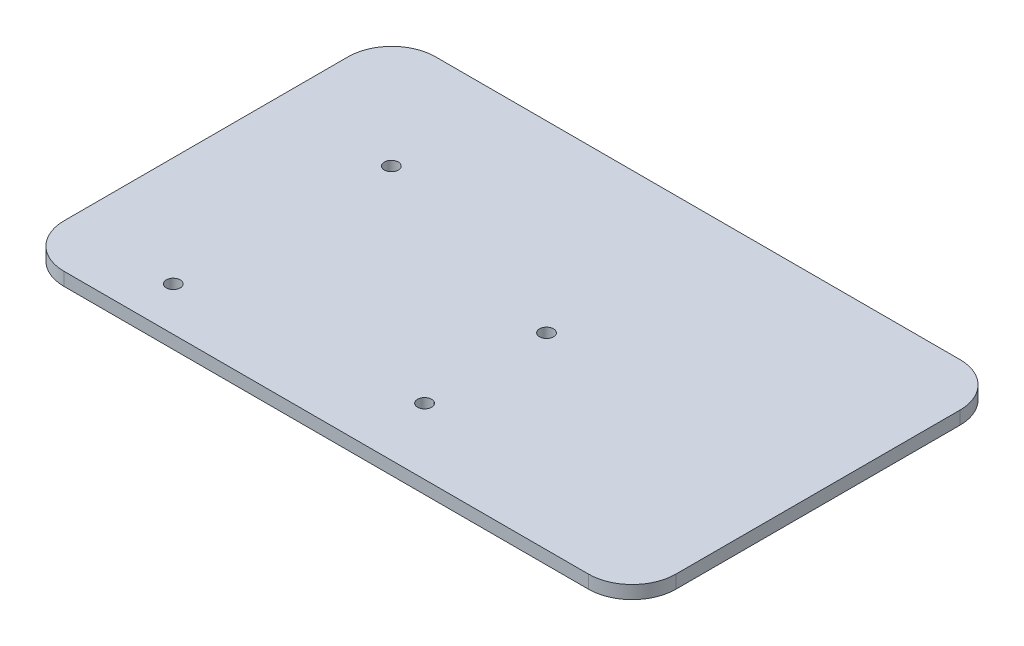
from build123d import *

# Parameters (mm, degrees)
SKETCH3_W           = 140
SKETCH3_H           = 85
BOSS_EXTRUDE1_DEPTH = 3
SKETCH4_R           = 1.6
CUT_EXTRUDE1_DEPTH  = 3
FILLET1_R           = 10
FILLET2_R           = 10
FILLET3_R           = 10
FILLET4_R           = 10


with BuildPart() as part:
    # Sketch3 → Boss-Extrude1 (new body)
    with BuildSketch(Plane(origin=(0, 0, 0), x_dir=(1, 0, 0), z_dir=(0, 1, 0))):
        Rectangle(SKETCH3_W, SKETCH3_H)
    extrude(amount=BOSS_EXTRUDE1_DEPTH)

    # Sketch4 → Cut-Extrude1 (cut)
    with BuildSketch(Plane(origin=(0, 3, 0), x_dir=(1, 0, 0), z_dir=(0, 1, 0))):
        with Locations((-43.4, 15.8)):
            Circle(SKETCH4_R)
        with Locations((7.4, 0.5)):
            Circle(SKETCH4_R)
        with Locations((-45, -32.5)):
            Circle(SKETCH4_R)
        with Locations((7.4, -27.4)):
            Circle(SKETCH4_R)
    extrude(amount=-CUT_EXTRUDE1_DEPTH, mode=Mode.SUBTRACT)

    # Fillet1
    fillet1_edges = [part.edges().sort_by_distance(p)[0] for p in [
        (-70, 1.5, 42.5),
    ]]
    fillet(fillet1_edges, radius=FILLET1_R)

    # Fillet2
    fillet2_edges = [part.edges().sort_by_distance(p)[0] for p in [
        (-70, 1.5, -42.5),
    ]]
    fillet(fillet2_edges, radius=FILLET2_R)

    # Fillet3
    fillet3_edges = [part.edges().sort_by_distance(p)[0] for p in [
        (70, 1.5, -42.5),
    ]]
    fillet(fillet3_edges, radius=FILLET3_R)

    # Fillet4
    fillet4_edges = [part.edges().sort_by_distance(p)[0] for p in [
        (70, 1.5, 42.5),
    ]]
    fillet(fillet4_edges, radius=FILLET4_R)


solid = part.part
